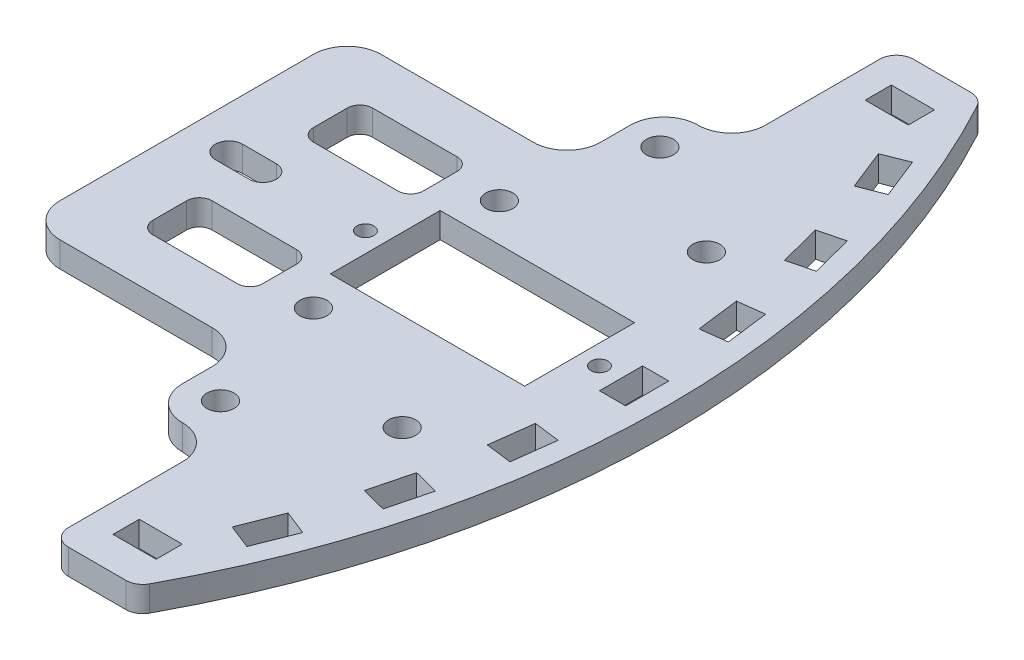
from build123d import *

# Parameters (mm, degrees)
CROQUIS1_W              = 50
CROQUIS1_H              = 61
SALIENTE_EXTRUIR1_DEPTH = 3
CROQUIS2_R              = 1.6
CORTAR_EXTRUIR1_DEPTH   = 40.550600501
CROQUIS4_R              = 1
CROQUIS4_W              = 23
CROQUIS4_H              = 13
CORTAR_EXTRUIR3_DEPTH   = 10
CROQUIS7_R              = 1.6
CORTAR_EXTRUIR5_DEPTH   = 10
CROQUIS5_W              = 13
CROQUIS5_H              = 7
CROQUIS5_W_2            = 26
CROQUIS5_H_2            = 11.5
CORTAR_EXTRUIR4_DEPTH   = 10
REDONDEO4_R             = 1.5
SALIENTE_EXTRUIR2_DEPTH = 3
REDONDEO3_DEPTH         = 3
REDONDEO3_2_DEPTH       = 3
REDONDEO5_R             = 2
CROQUIS9_R              = 1.6
CORTAR_EXTRUIR6_DEPTH   = 60.41214848
CORTAR_EXTRUIR7_DEPTH   = 10
MATRIZ_CRV1_OUTLINE_W   = 3.1
MATRIZ_CRV1_OUTLINE_H   = 5.1
MATRIZ_CRV1_DEPTH       = 3
CROQUIS11_W             = 5.1
CROQUIS11_H             = 3.1
CORTAR_EXTRUIR8_DEPTH   = 3


with BuildPart() as part:
    # Croquis1 → Saliente-Extruir1 (new body)
    with BuildSketch(Plane(origin=(0, 0, 0), x_dir=(1, 0, 0), z_dir=(0, 1, 0))):
        Rectangle(CROQUIS1_W, CROQUIS1_H)
    extrude(amount=SALIENTE_EXTRUIR1_DEPTH)

    # Croquis2 → Cortar-Extruir1 (cut, through all)
    with BuildSketch(Plane(origin=(0, 3, 0), x_dir=(1, 0, 0), z_dir=(0, 1, 0))):
        with Locations(Location((1, 11, 0), (0, 0, 270))):
            Circle(CROQUIS2_R)
        with Locations(Location((1, -11, 0), (0, 0, 270))):
            Circle(CROQUIS2_R)
        with BuildLine():
            Line((-16, -1.6), (-20, -1.6))
            ThreePointArc((-20, -1.6), (-21.6, 0), (-20, 1.6))
            Line((-20, 1.6), (-16, 1.6))
            ThreePointArc((-16, 1.6), (-14.4, 0), (-16, -1.6))
        make_face()
    extrude(amount=-CORTAR_EXTRUIR1_DEPTH, mode=Mode.SUBTRACT)

    # Croquis4 → Cortar-Extruir3 (cut)
    with BuildSketch(Plane(origin=(0, 3, 0), x_dir=(1, 0, 0), z_dir=(0, 1, 0))):
        with Locations(Location((-3.85, 0, 0), (0, 0, 270))):
            Circle(CROQUIS4_R)
        with Locations(Location((23.85, 0, 0), (0, 0, 270))):
            Circle(CROQUIS4_R)
        with Locations((10, 0)):
            Rectangle(CROQUIS4_W, CROQUIS4_H)
    extrude(amount=-CORTAR_EXTRUIR3_DEPTH, mode=Mode.SUBTRACT)

    # Croquis7 → Cortar-Extruir5 (cut)
    with BuildSketch(Plane(origin=(0, 3, 0), x_dir=(1, 0, 0), z_dir=(0, 1, 0))):
        with Locations(Location((5, 26, 0), (0, 0, 270))):
            Circle(CROQUIS7_R)
        with Locations(Location((5, -26, 0), (0, 0, 270))):
            Circle(CROQUIS7_R)
    extrude(amount=-CORTAR_EXTRUIR5_DEPTH, mode=Mode.SUBTRACT)

    # Croquis5 → Cortar-Extruir4 (cut)
    with BuildSketch(Plane(origin=(0, 3, 0), x_dir=(1, 0, 0), z_dir=(0, 1, 0))):
        with Locations((-11, 9.5)):
            Rectangle(CROQUIS5_W, CROQUIS5_H)
        with Locations((-11, -9.5)):
            Rectangle(CROQUIS5_W, CROQUIS5_H)
        with Locations((-12, 24.75)):
            Rectangle(CROQUIS5_W_2, CROQUIS5_H_2)
        with Locations((-12, -24.75)):
            Rectangle(CROQUIS5_W_2, CROQUIS5_H_2)
    extrude(amount=-CORTAR_EXTRUIR4_DEPTH, mode=Mode.SUBTRACT)

    # Redondeo4
    redondeo4_edges = [part.edges().sort_by_distance(p)[0] for p in [
        (-4.5, 1.5, 6),
        (-4.5, 1.5, 13),
        (-17.5, 1.5, 13),
        (-17.5, 1.5, 6),
        (-4.5, 1.5, -13),
        (-4.5, 1.5, -6),
        (-17.5, 1.5, -6),
        (-17.5, 1.5, -13),
    ]]
    fillet(redondeo4_edges, radius=REDONDEO4_R)

    # Croquis8 → Saliente-Extruir2 (add, through all)
    with BuildSketch(Plane(origin=(0, 3, 0), x_dir=(1, 0, 0), z_dir=(0, 1, 0))):
        with BuildLine():
            Line((9, -50), (19, -50))
            ThreePointArc((19, -50), (31.950013881, 0), (19, 50))
            Line((19, 50), (9, 50))
            Line((9, 50), (9, 30.5))
            Line((9, 30.5), (25, 30.5))
            Line((25, 30.5), (25, -30.5))
            Line((25, -30.5), (9, -30.5))
            Line((9, -30.5), (9, -50))
        make_face()
    extrude(amount=-SALIENTE_EXTRUIR2_DEPTH)

    # Redondeo3: read off the stored shape, not the designer's step
    # Redondeo3 outline → Redondeo3 (cut)
    with BuildSketch(Plane(origin=(0, 0, 0), x_dir=(1, 0, 0), z_dir=(0, 1, 0))):
        with BuildLine():
            ThreePointArc((5, -30.5), (2.171572875, -29.328427125), (1, -26.5))
            Line((1, -26.5), (1, -30.5))
            Line((1, -30.5), (5, -30.5))
        make_face()
        with BuildLine():
            Line((1, 30.5), (1, 26.5))
            ThreePointArc((1, 26.5), (2.171572875, 29.328427125), (5, 30.5))
            Line((5, 30.5), (1, 30.5))
        make_face()
        with BuildLine():
            Line((-25, 19), (-25, 15))
            ThreePointArc((-25, 15), (-23.828427125, 17.828427125), (-21, 19))
            Line((-21, 19), (-25, 19))
        make_face()
        with BuildLine():
            Line((-25, -19), (-21, -19))
            ThreePointArc((-21, -19), (-23.828427125, -17.828427125), (-25, -15))
            Line((-25, -15), (-25, -19))
        make_face()
    extrude(amount=REDONDEO3_DEPTH, mode=Mode.SUBTRACT)

    # Redondeo3 2 outline → Redondeo3 2 (add)
    with BuildSketch(Plane(origin=(0, 0, 0), x_dir=(1, 0, 0), z_dir=(0, 1, 0))):
        with BuildLine():
            Line((9, -30.5), (5, -30.5))
            ThreePointArc((5, -30.5), (7.828427125, -31.671572875), (9, -34.5))
            Line((9, -34.5), (9, -30.5))
        make_face()
        with BuildLine():
            ThreePointArc((9, 34.5), (7.828427125, 31.671572875), (5, 30.5))
            Line((5, 30.5), (9, 30.5))
            Line((9, 30.5), (9, 34.5))
        make_face()
        with BuildLine():
            ThreePointArc((1, 23), (-0.171572875, 20.171572875), (-3, 19))
            Line((-3, 19), (1, 19))
            Line((1, 19), (1, 23))
        make_face()
        with BuildLine():
            ThreePointArc((-3, -19), (-0.171572875, -20.171572875), (1, -23))
            Line((1, -23), (1, -19))
            Line((1, -19), (-3, -19))
        make_face()
    extrude(amount=REDONDEO3_2_DEPTH)

    # Redondeo5
    redondeo5_edges = [part.edges().sort_by_distance(p)[0] for p in [
        (9, 1.5, 50),
        (9, 1.5, -50),
        (19, 1.5, -50),
        (19, 1.5, 50),
    ]]
    fillet(redondeo5_edges, radius=REDONDEO5_R)

    # Croquis9 → Cortar-Extruir6 (cut, through all)
    with BuildSketch(Plane(origin=(0, 3, 0), x_dir=(1, 0, 0), z_dir=(0, 1, 0))):
        with Locations(Location((18.5, 18, 0), (0, 0, 270))):
            Circle(CROQUIS9_R)
        with Locations(Location((18.5, -18, 0), (0, 0, 270))):
            Circle(CROQUIS9_R)
    extrude(amount=-CORTAR_EXTRUIR6_DEPTH, mode=Mode.SUBTRACT)

    # Croquis10 → Cortar-Extruir7 (cut)
    with BuildSketch(Plane(origin=(0, 3, 0), x_dir=(1, 0, 0), z_dir=(0, 1, 0))):
        Polygon((21.502606584, 39.380484813), (23.379766719, 34.638515831), (20.497393416, 33.497496925), (18.620233281, 38.239465907), align=None)
    extrude(amount=-CORTAR_EXTRUIR7_DEPTH, mode=Mode.SUBTRACT)

    # Matriz Crv1: read off the stored shape, not the designer's step
    # Matriz Crv1 outline → Matriz Crv1 (cut)
    with BuildSketch(Plane(origin=(0, 0, 0), x_dir=(1, 0, 0), z_dir=(0, 1, 0))):
        Polygon((21.502606584, -39.380484813), (23.379766719, -34.638515831), (20.497393416, -33.497496925), (18.620233281, -38.239465907), align=None)
        Polygon((25.707954041, -27.471913222), (26.976081424, -22.532090053), (23.973443811, -21.761267526), (22.705316428, -26.701090695), align=None)
        Polygon((28.387839944, -15.130226298), (29.026941594, -10.070428962), (25.951378508, -9.68195541), (25.312276858, -14.741752746), align=None)
        with Locations((27.950013881, 0)):
            Rectangle(MATRIZ_CRV1_OUTLINE_W, MATRIZ_CRV1_OUTLINE_H)
        Polygon((29.026941594, 10.070428962), (28.387839944, 15.130226298), (25.312276858, 14.741752746), (25.951378508, 9.68195541), align=None)
        Polygon((26.976081424, 22.532090053), (25.707954041, 27.471913222), (22.705316428, 26.701090695), (23.973443811, 21.761267526), align=None)
    extrude(amount=MATRIZ_CRV1_DEPTH, mode=Mode.SUBTRACT)

    # Croquis11 → Cortar-Extruir8 (cut)
    with BuildSketch(Plane(origin=(0, 3, 0), x_dir=(1, 0, 0), z_dir=(0, 1, 0))):
        with Locations((14.885018263, 44.5)):
            Rectangle(CROQUIS11_W, CROQUIS11_H)
    cortar_extruir8 = extrude(amount=-CORTAR_EXTRUIR8_DEPTH, mode=Mode.SUBTRACT)

    # Simetría1: Cortar-Extruir8 across plane
    add(cortar_extruir8.mirror(Plane.XY), mode=Mode.SUBTRACT)


solid = part.part
